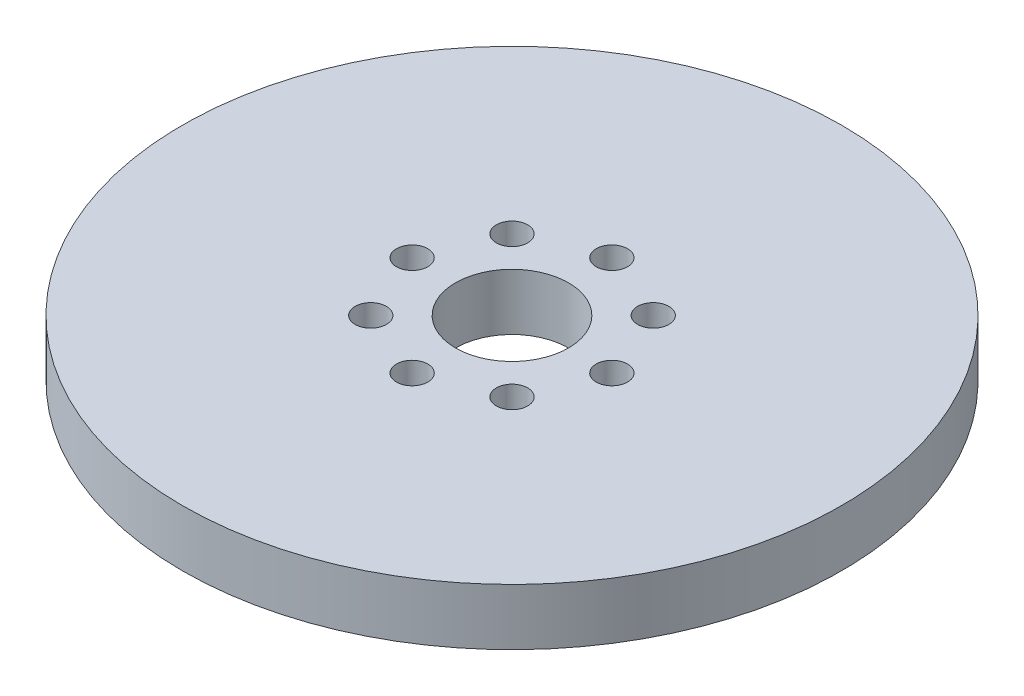
from build123d import *

# Parameters (mm, degrees)
SKETCH1_R           = 87.5
BOSS_EXTRUDE1_DEPTH = 15
SKETCH2_R           = 15
CUT_EXTRUDE1_DEPTH  = 125.649508623
SKETCH3_R           = 4.161824297
CUT_EXTRUDE2_DEPTH  = 12.789838385
CIRPATTERN1_COUNT   = 8


with BuildPart() as part:
    # Sketch1 → Boss-Extrude1 (new body)
    with BuildSketch(Plane(origin=(0, 0, 0), x_dir=(1, 0, 0), z_dir=(0, 1, 0))):
        Circle(SKETCH1_R)
    extrude(amount=BOSS_EXTRUDE1_DEPTH)

    # Sketch2 → Cut-Extrude1 (cut, through all)
    with BuildSketch(Plane(origin=(0, 0, 0), x_dir=(1, 0, 0), z_dir=(0, 1, 0))):
        Circle(SKETCH2_R)
    extrude(amount=CUT_EXTRUDE1_DEPTH, mode=Mode.SUBTRACT)

    # Sketch3 → Cut-Extrude2 (cut)
    with BuildSketch(Plane(origin=(0, 15, 0), x_dir=(1, 0, 0), z_dir=(0, 1, 0))):
        with Locations((-26.516519586, 0)):
            Circle(SKETCH3_R)
    cut_extrude2 = extrude(amount=-CUT_EXTRUDE2_DEPTH, mode=Mode.SUBTRACT)

    # CirPattern1: Cut-Extrude2 ×8 about axis
    cirpattern1_axis = Axis((0, 0, 0), (0, 1, 0))
    for i in range(1, CIRPATTERN1_COUNT):
        add(cut_extrude2.rotate(cirpattern1_axis, i * 360 / CIRPATTERN1_COUNT), mode=Mode.SUBTRACT)


solid = part.part
